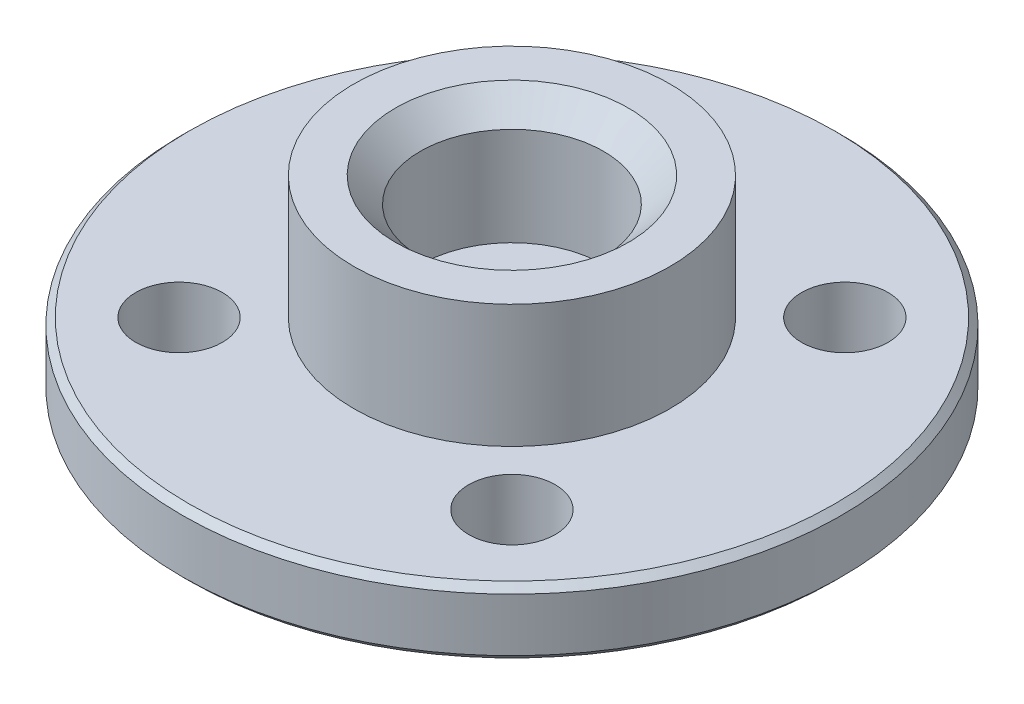
from build123d import *

# Parameters (mm, degrees)
SKETCH1_R           = 9.9
BOSS_EXTRUDE1_DEPTH = 2
SKETCH2_R           = 4.75
SKETCH2_R_2         = 2.75
BOSS_EXTRUDE2_DEPTH = 3.7
CUT_EXTRUDE1_REACH  = 17.117
SKETCH3_R           = 1.3
SKETCH3_R_2         = 1.45
CHAMFER1_SIZE       = 0.75
CHAMFER2_SIZE       = 0.2


with BuildPart() as part:
    # Sketch1 → Boss-Extrude1 (new body)
    with BuildSketch(Plane(origin=(0, 0, 0), x_dir=(1, 0, 0), z_dir=(0, 1, 0))):
        Circle(SKETCH1_R)
    extrude(amount=BOSS_EXTRUDE1_DEPTH)

    # Sketch2 → Boss-Extrude2 (add)
    with BuildSketch(Plane(origin=(0, 2, 0), x_dir=(1, 0, 0), z_dir=(0, 1, 0))):
        Circle(SKETCH2_R)
        Circle(SKETCH2_R_2, mode=Mode.SUBTRACT)
    extrude(amount=BOSS_EXTRUDE2_DEPTH)

    # Sketch3 → Cut-Extrude1 (cut, up to next)
    with BuildSketch(Plane.XZ, mode=Mode.PRIVATE) as cut_extrude1_sk1:
        with Locations((-5, 5)):
            Circle(SKETCH3_R)
    cut_extrude1_tool1 = extrude(cut_extrude1_sk1.sketch, amount=-CUT_EXTRUDE1_REACH, mode=Mode.PRIVATE) & part.part
    # Sketch3 → Cut-Extrude1 (cut, up to next)
    with BuildSketch(Plane.XZ, mode=Mode.PRIVATE) as cut_extrude1_sk2:
        with Locations((5, 5)):
            Circle(SKETCH3_R)
    cut_extrude1_tool2 = extrude(cut_extrude1_sk2.sketch, amount=-CUT_EXTRUDE1_REACH, mode=Mode.PRIVATE) & part.part
    # Sketch3 → Cut-Extrude1 (cut, up to next)
    with BuildSketch(Plane.XZ, mode=Mode.PRIVATE) as cut_extrude1_sk3:
        with Locations((-5, -5)):
            Circle(SKETCH3_R)
    cut_extrude1_tool3 = extrude(cut_extrude1_sk3.sketch, amount=-CUT_EXTRUDE1_REACH, mode=Mode.PRIVATE) & part.part
    # Sketch3 → Cut-Extrude1 (cut, up to next)
    with BuildSketch(Plane.XZ, mode=Mode.PRIVATE) as cut_extrude1_sk4:
        with Locations((5, -5)):
            Circle(SKETCH3_R)
    cut_extrude1_tool4 = extrude(cut_extrude1_sk4.sketch, amount=-CUT_EXTRUDE1_REACH, mode=Mode.PRIVATE) & part.part
    # Sketch3 → Cut-Extrude1 (cut, up to next)
    with BuildSketch(Plane.XZ, mode=Mode.PRIVATE) as cut_extrude1_sk5:
        Circle(SKETCH3_R_2)
    cut_extrude1_tool5 = extrude(cut_extrude1_sk5.sketch, amount=-CUT_EXTRUDE1_REACH, mode=Mode.PRIVATE) & part.part
    add(cut_extrude1_tool1.solids().sort_by_distance((-5, 0, 5))[0], mode=Mode.SUBTRACT)
    add(cut_extrude1_tool2.solids().sort_by_distance((5, 0, 5))[0], mode=Mode.SUBTRACT)
    add(cut_extrude1_tool3.solids().sort_by_distance((-5, 0, -5))[0], mode=Mode.SUBTRACT)
    add(cut_extrude1_tool4.solids().sort_by_distance((5, 0, -5))[0], mode=Mode.SUBTRACT)
    add(cut_extrude1_tool5.solids().sort_by_distance((0, 0, 0))[0], mode=Mode.SUBTRACT)

    # Chamfer1
    chamfer1_edges = [part.edges().sort_by_distance(p)[0] for p in [
        (-2.75, 5.7, 0),
    ]]
    chamfer(chamfer1_edges, length=CHAMFER1_SIZE)

    # Chamfer2
    chamfer2_edges = [part.edges().sort_by_distance(p)[0] for p in [
        (-9.9, 0, 0),
        (-9.9, 2, 0),
    ]]
    chamfer(chamfer2_edges, length=CHAMFER2_SIZE)


solid = part.part
